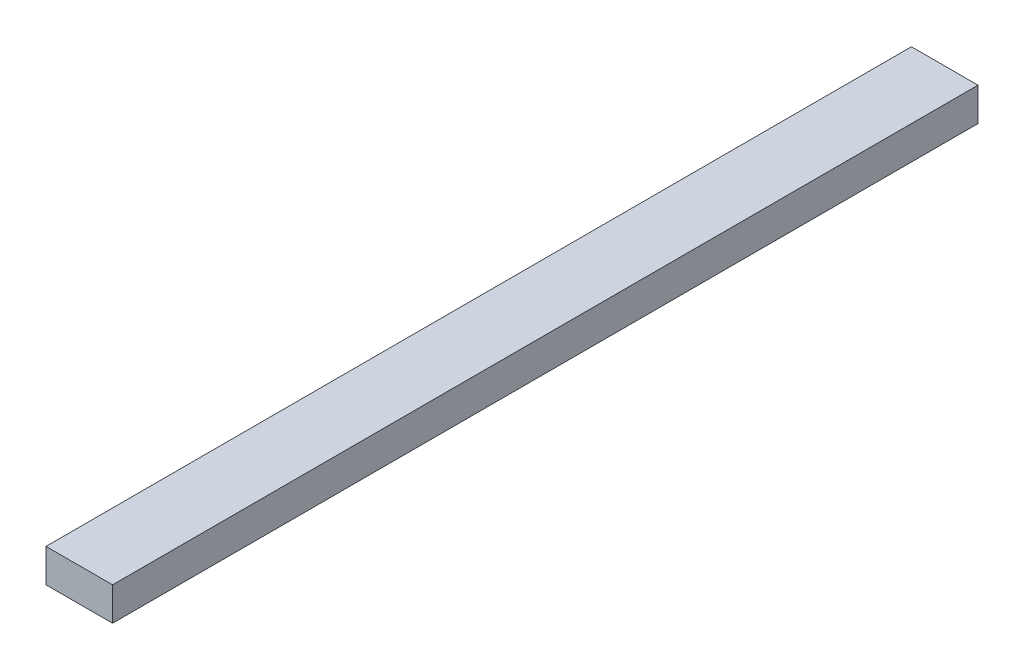
from build123d import *

# Parameters (mm, degrees)
SKETCH1_W           = 50.8
SKETCH1_H           = 25.4
BOSS_EXTRUDE1_DEPTH = 660.4


with BuildPart() as part:
    # Sketch1 → Boss-Extrude1 (new body)
    with BuildSketch(Plane.XY):
        with Locations((25.4, 12.7)):
            Rectangle(SKETCH1_W, SKETCH1_H)
    extrude(amount=BOSS_EXTRUDE1_DEPTH)


solid = part.part
